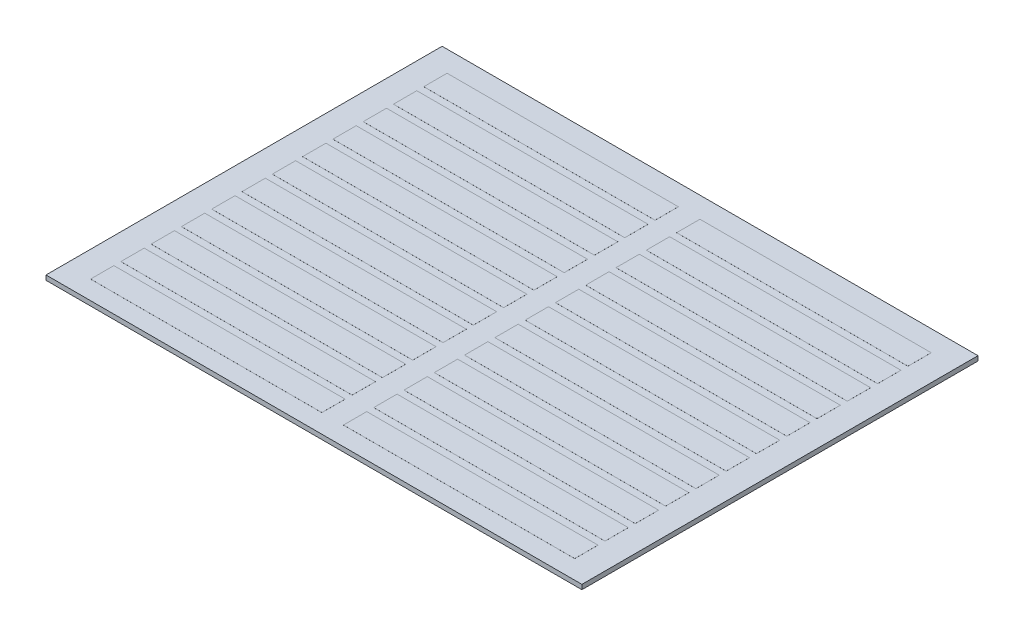
from build123d import *

# Parameters (mm, degrees)
SKETCH_1_W                = 115
SKETCH_1_H                = 85
EXTRUDE_1_DEPTH           = 1
SKETCH_2_W                = 49.628548445
SKETCH_2_H                = 5
EXTRUDE_2_DEPTH           = 0.01
PATTERN_LINEAR_1_COUNT    = 12
PATTERN_LINEAR_1_PITCH    = 6.5
MIRROR_1_COPY_1_SKETCH_W  = 49.628548445
MIRROR_1_COPY_1_SKETCH_H  = 5
MIRROR_1_COPY_1_DEPTH     = 0.01
MIRROR_1_COPY_2_SKETCH_W  = 49.628548445
MIRROR_1_COPY_2_SKETCH_H  = 5
MIRROR_1_COPY_2_DEPTH     = 0.01
MIRROR_1_COPY_3_SKETCH_W  = 49.628548445
MIRROR_1_COPY_3_SKETCH_H  = 5
MIRROR_1_COPY_3_DEPTH     = 0.01
MIRROR_1_COPY_4_SKETCH_W  = 49.628548445
MIRROR_1_COPY_4_SKETCH_H  = 5
MIRROR_1_COPY_4_DEPTH     = 0.01
MIRROR_1_COPY_5_SKETCH_W  = 49.628548445
MIRROR_1_COPY_5_SKETCH_H  = 5
MIRROR_1_COPY_5_DEPTH     = 0.01
MIRROR_1_COPY_6_SKETCH_W  = 49.628548445
MIRROR_1_COPY_6_SKETCH_H  = 5
MIRROR_1_COPY_6_DEPTH     = 0.01
MIRROR_1_COPY_7_SKETCH_W  = 49.628548445
MIRROR_1_COPY_7_SKETCH_H  = 5
MIRROR_1_COPY_7_DEPTH     = 0.01
MIRROR_1_COPY_8_SKETCH_W  = 49.628548445
MIRROR_1_COPY_8_SKETCH_H  = 5
MIRROR_1_COPY_8_DEPTH     = 0.01
MIRROR_1_COPY_9_SKETCH_W  = 49.628548445
MIRROR_1_COPY_9_SKETCH_H  = 5
MIRROR_1_COPY_9_DEPTH     = 0.01
MIRROR_1_COPY_10_SKETCH_W = 49.628548445
MIRROR_1_COPY_10_SKETCH_H = 5
MIRROR_1_COPY_10_DEPTH    = 0.01
MIRROR_1_COPY_11_SKETCH_W = 49.628548445
MIRROR_1_COPY_11_SKETCH_H = 5
MIRROR_1_COPY_11_DEPTH    = 0.01
MIRROR_1_COPY_12_SKETCH_W = 49.628548445
MIRROR_1_COPY_12_SKETCH_H = 5
MIRROR_1_COPY_12_DEPTH    = 0.01


with BuildPart() as part:
    # Эскиз1 → Бобышка-Вытянуть1 (new body)
    with BuildSketch(Plane(origin=(0, 0, 0), x_dir=(1, 0, 0), z_dir=(0, 1, 0))):
        Rectangle(SKETCH_1_W, SKETCH_1_H)
    extrude(amount=EXTRUDE_1_DEPTH)

    # Эскиз2 → Бобышка-Вытянуть2 (add)
    with BuildSketch(Plane(origin=(0, 1, 0), x_dir=(1, 0, 0), z_dir=(0, 1, 0))):
        with Locations((27.130748896, -35.988250825)):
            Rectangle(SKETCH_2_W, SKETCH_2_H)
    extrude_2 = extrude(amount=EXTRUDE_2_DEPTH)

    # Линейный массив1: Бобышка-Вытянуть2 ×12
    with Locations(*[(0, 0, -i * PATTERN_LINEAR_1_PITCH) for i in range(1, PATTERN_LINEAR_1_COUNT)]):
        add(extrude_2)

    # Зеркальное отражение1 copy 1 sketch → Зеркальное отражение1 copy 1 (add)
    with BuildSketch(Plane(origin=(0, 1, -6.5), x_dir=(-1, 0, 0), z_dir=(0, 1, 0))):
        with Locations((27.130748896, 35.988250825)):
            Rectangle(MIRROR_1_COPY_1_SKETCH_W, MIRROR_1_COPY_1_SKETCH_H)
    extrude(amount=MIRROR_1_COPY_1_DEPTH)

    # Зеркальное отражение1 copy 2 sketch → Зеркальное отражение1 copy 2 (add)
    with BuildSketch(Plane(origin=(0, 1, -13), x_dir=(-1, 0, 0), z_dir=(0, 1, 0))):
        with Locations((27.130748896, 35.988250825)):
            Rectangle(MIRROR_1_COPY_2_SKETCH_W, MIRROR_1_COPY_2_SKETCH_H)
    extrude(amount=MIRROR_1_COPY_2_DEPTH)

    # Зеркальное отражение1 copy 3 sketch → Зеркальное отражение1 copy 3 (add)
    with BuildSketch(Plane(origin=(0, 1, -19.5), x_dir=(-1, 0, 0), z_dir=(0, 1, 0))):
        with Locations((27.130748896, 35.988250825)):
            Rectangle(MIRROR_1_COPY_3_SKETCH_W, MIRROR_1_COPY_3_SKETCH_H)
    extrude(amount=MIRROR_1_COPY_3_DEPTH)

    # Зеркальное отражение1 copy 4 sketch → Зеркальное отражение1 copy 4 (add)
    with BuildSketch(Plane(origin=(0, 1, -26), x_dir=(-1, 0, 0), z_dir=(0, 1, 0))):
        with Locations((27.130748896, 35.988250825)):
            Rectangle(MIRROR_1_COPY_4_SKETCH_W, MIRROR_1_COPY_4_SKETCH_H)
    extrude(amount=MIRROR_1_COPY_4_DEPTH)

    # Зеркальное отражение1 copy 5 sketch → Зеркальное отражение1 copy 5 (add)
    with BuildSketch(Plane(origin=(0, 1, -32.5), x_dir=(-1, 0, 0), z_dir=(0, 1, 0))):
        with Locations((27.130748896, 35.988250825)):
            Rectangle(MIRROR_1_COPY_5_SKETCH_W, MIRROR_1_COPY_5_SKETCH_H)
    extrude(amount=MIRROR_1_COPY_5_DEPTH)

    # Зеркальное отражение1 copy 6 sketch → Зеркальное отражение1 copy 6 (add)
    with BuildSketch(Plane(origin=(0, 1, -39), x_dir=(-1, 0, 0), z_dir=(0, 1, 0))):
        with Locations((27.130748896, 35.988250825)):
            Rectangle(MIRROR_1_COPY_6_SKETCH_W, MIRROR_1_COPY_6_SKETCH_H)
    extrude(amount=MIRROR_1_COPY_6_DEPTH)

    # Зеркальное отражение1 copy 7 sketch → Зеркальное отражение1 copy 7 (add)
    with BuildSketch(Plane(origin=(0, 1, -45.5), x_dir=(-1, 0, 0), z_dir=(0, 1, 0))):
        with Locations((27.130748896, 35.988250825)):
            Rectangle(MIRROR_1_COPY_7_SKETCH_W, MIRROR_1_COPY_7_SKETCH_H)
    extrude(amount=MIRROR_1_COPY_7_DEPTH)

    # Зеркальное отражение1 copy 8 sketch → Зеркальное отражение1 copy 8 (add)
    with BuildSketch(Plane(origin=(0, 1, -52), x_dir=(-1, 0, 0), z_dir=(0, 1, 0))):
        with Locations((27.130748896, 35.988250825)):
            Rectangle(MIRROR_1_COPY_8_SKETCH_W, MIRROR_1_COPY_8_SKETCH_H)
    extrude(amount=MIRROR_1_COPY_8_DEPTH)

    # Зеркальное отражение1 copy 9 sketch → Зеркальное отражение1 copy 9 (add)
    with BuildSketch(Plane(origin=(0, 1, -58.5), x_dir=(-1, 0, 0), z_dir=(0, 1, 0))):
        with Locations((27.130748896, 35.988250825)):
            Rectangle(MIRROR_1_COPY_9_SKETCH_W, MIRROR_1_COPY_9_SKETCH_H)
    extrude(amount=MIRROR_1_COPY_9_DEPTH)

    # Зеркальное отражение1 copy 10 sketch → Зеркальное отражение1 copy 10 (add)
    with BuildSketch(Plane(origin=(0, 1, -65), x_dir=(-1, 0, 0), z_dir=(0, 1, 0))):
        with Locations((27.130748896, 35.988250825)):
            Rectangle(MIRROR_1_COPY_10_SKETCH_W, MIRROR_1_COPY_10_SKETCH_H)
    extrude(amount=MIRROR_1_COPY_10_DEPTH)

    # Зеркальное отражение1 copy 11 sketch → Зеркальное отражение1 copy 11 (add)
    with BuildSketch(Plane(origin=(0, 1, -71.5), x_dir=(-1, 0, 0), z_dir=(0, 1, 0))):
        with Locations((27.130748896, 35.988250825)):
            Rectangle(MIRROR_1_COPY_11_SKETCH_W, MIRROR_1_COPY_11_SKETCH_H)
    extrude(amount=MIRROR_1_COPY_11_DEPTH)

    # Зеркальное отражение1 copy 12 sketch → Зеркальное отражение1 copy 12 (add)
    with BuildSketch(Plane(origin=(0, 1, 0), x_dir=(-1, 0, 0), z_dir=(0, 1, 0))):
        with Locations((27.130748896, 35.988250825)):
            Rectangle(MIRROR_1_COPY_12_SKETCH_W, MIRROR_1_COPY_12_SKETCH_H)
    extrude(amount=MIRROR_1_COPY_12_DEPTH)


solid = part.part
